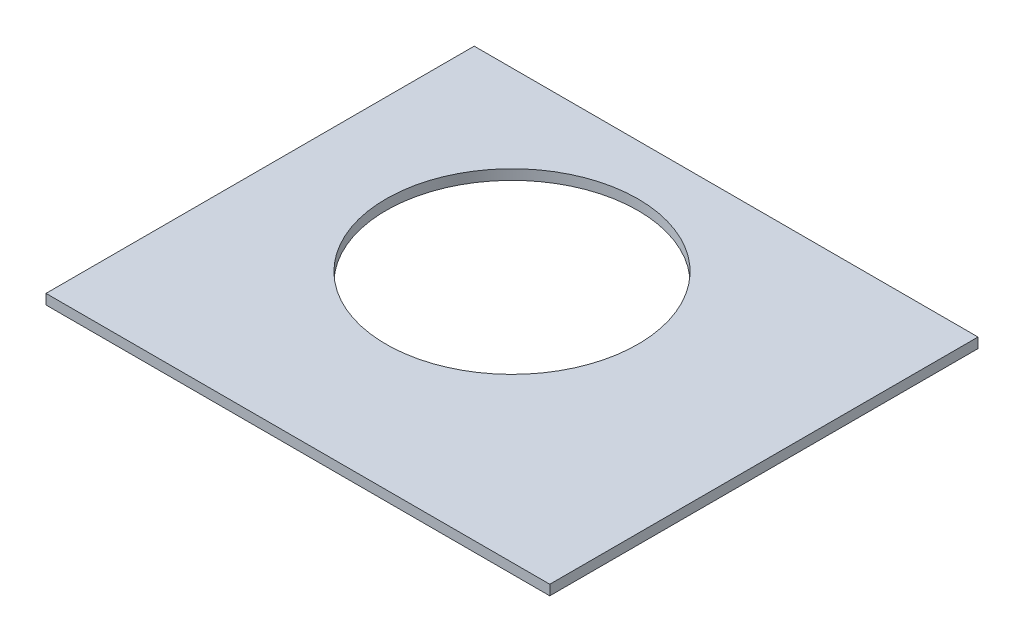
from build123d import *

# Parameters (mm, degrees)
SKETCH1_W           = 200
SKETCH1_H           = 170
BOSS_EXTRUDE1_DEPTH = 4
SKETCH7_R           = 50
CUT_EXTRUDE9_DEPTH  = 6


with BuildPart() as part:
    # Sketch1 → Boss-Extrude1 (new body)
    with BuildSketch(Plane(origin=(0, 0, 0), x_dir=(1, 0, 0), z_dir=(0, 1, 0))):
        with Locations((100, 85)):
            Rectangle(SKETCH1_W, SKETCH1_H)
    extrude(amount=BOSS_EXTRUDE1_DEPTH)

    # Sketch7 → Cut-Extrude9 (cut)
    with BuildSketch(Plane(origin=(0, 0, 0), x_dir=(1, 0, 0), z_dir=(0, 1, 0))):
        with Locations((85, 100)):
            Circle(SKETCH7_R)
    extrude(amount=CUT_EXTRUDE9_DEPTH, mode=Mode.SUBTRACT)


solid = part.part
